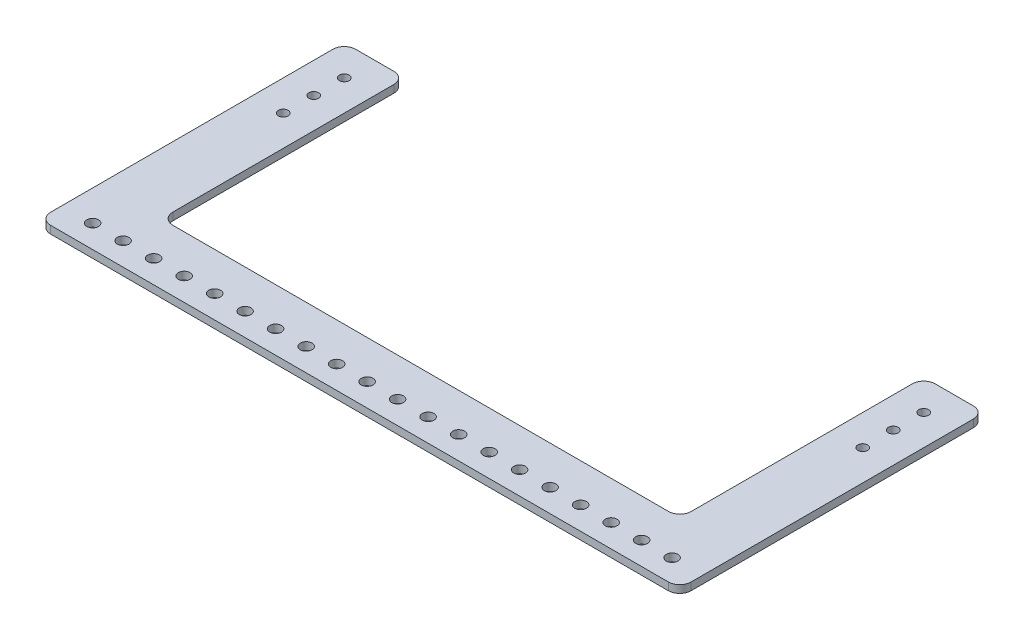
from build123d import *

# Parameters (mm, degrees)
SKETCH2_R           = 2.0193
BOSS_EXTRUDE1_DEPTH = 3.175
FILLET1_R           = 4.7625
SKETCH3_R           = 2.4384
CUT_EXTRUDE1_DEPTH  = 148.731354576


with BuildPart() as part:
    # Sketch2 → Boss-Extrude1 (new body)
    with BuildSketch(Plane(origin=(0, 0, 0), x_dir=(1, 0, 0), z_dir=(0, 1, 0))):
        Polygon((-133.35, 63.5), (-133.35, -63.5), (133.35, -63.5), (133.35, 63.5), (107.95, 63.5), (107.95, -38.0365), (-107.95, -38.0365), (-107.95, 63.5), align=None)
        with Locations((-120.65, 25.4)):
            Circle(SKETCH2_R, mode=Mode.SUBTRACT)
        with Locations((-120.65, 38.1)):
            Circle(SKETCH2_R, mode=Mode.SUBTRACT)
        with Locations((-120.65, 50.8)):
            Circle(SKETCH2_R, mode=Mode.SUBTRACT)
        with Locations((120.65, 25.4)):
            Circle(SKETCH2_R, mode=Mode.SUBTRACT)
        with Locations((120.65, 38.1)):
            Circle(SKETCH2_R, mode=Mode.SUBTRACT)
        with Locations((120.65, 50.8)):
            Circle(SKETCH2_R, mode=Mode.SUBTRACT)
    extrude(amount=BOSS_EXTRUDE1_DEPTH)

    # Fillet1
    fillet1_edges = [part.edges().sort_by_distance(p)[0] for p in [
        (133.35, 1.5875, -63.5),
        (-133.35, 1.5875, 63.5),
        (-133.35, 1.5875, -63.5),
        (-107.95, 1.5875, -63.5),
        (-107.95, 1.5875, 38.0365),
        (107.95, 1.5875, 38.0365),
        (107.95, 1.5875, -63.5),
        (133.35, 1.5875, 63.5),
    ]]
    fillet(fillet1_edges, radius=FILLET1_R)

    # Sketch3 → Cut-Extrude1 (cut, through all)
    with BuildSketch(Plane(origin=(0, 3.175, 0), x_dir=(1, 0, 0), z_dir=(0, 1, 0))):
        with Locations((-120.65, -53.975)):
            Circle(SKETCH3_R)
        with Locations((-107.95, -53.975)):
            Circle(SKETCH3_R)
        with Locations((-95.25, -53.975)):
            Circle(SKETCH3_R)
        with Locations((-82.55, -53.975)):
            Circle(SKETCH3_R)
        with Locations((-69.85, -53.975)):
            Circle(SKETCH3_R)
        with Locations((-57.15, -53.975)):
            Circle(SKETCH3_R)
        with Locations((-44.45, -53.975)):
            Circle(SKETCH3_R)
        with Locations((-31.75, -53.975)):
            Circle(SKETCH3_R)
        with Locations((-19.05, -53.975)):
            Circle(SKETCH3_R)
        with Locations((-6.35, -53.975)):
            Circle(SKETCH3_R)
        with Locations((6.35, -53.975)):
            Circle(SKETCH3_R)
        with Locations((19.05, -53.975)):
            Circle(SKETCH3_R)
        with Locations((31.75, -53.975)):
            Circle(SKETCH3_R)
        with Locations((44.45, -53.975)):
            Circle(SKETCH3_R)
        with Locations((57.15, -53.975)):
            Circle(SKETCH3_R)
        with Locations((69.85, -53.975)):
            Circle(SKETCH3_R)
        with Locations((82.55, -53.975)):
            Circle(SKETCH3_R)
        with Locations((95.25, -53.975)):
            Circle(SKETCH3_R)
        with Locations((107.95, -53.975)):
            Circle(SKETCH3_R)
        with Locations((120.65, -53.975)):
            Circle(SKETCH3_R)
    extrude(amount=-CUT_EXTRUDE1_DEPTH, mode=Mode.SUBTRACT)


solid = part.part
